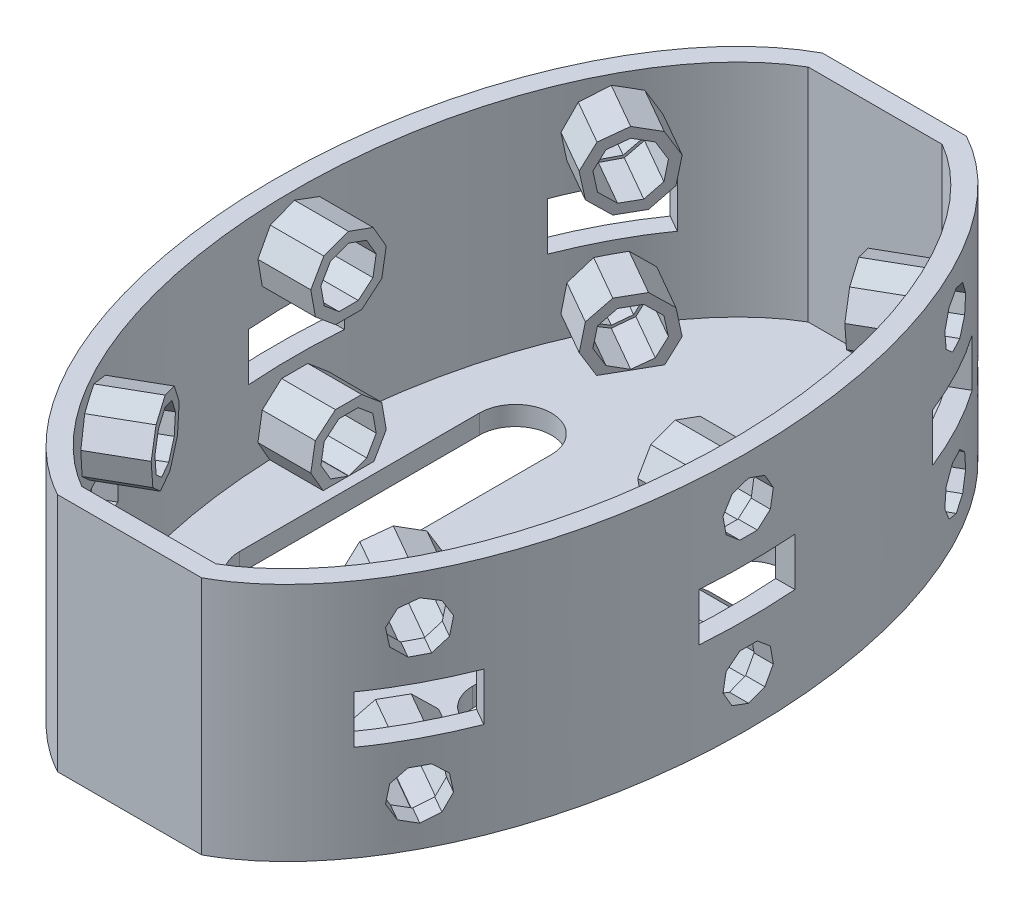
from build123d import *

# Parameters (mm, degrees)
BOSS_EXTRUDE2_DEPTH      = 50
SHELL2_T                 = -4
CUT_EXTRUDE4_DEPTH       = 10
SKETCH8_W                = 20
SKETCH8_H                = 10
CUT_EXTRUDE5_DEPTH       = 10
SKETCH9_W                = 20
SKETCH9_H                = 10
CUT_EXTRUDE6_DEPTH       = 10
SKETCH11_W               = 20
SKETCH11_H               = 10
CUT_EXTRUDE7_DEPTH       = 10
BOSS_EXTRUDE4_DEPTH      = 10
BOSS_EXTRUDE4_DEPTH_BACK = 3
BOSS_EXTRUDE5_DEPTH      = 10
BOSS_EXTRUDE5_DEPTH_BACK = 3
BOSS_EXTRUDE6_DEPTH      = 12.5
BOSS_EXTRUDE6_DEPTH_BACK = 2
BOSS_EXTRUDE7_DEPTH      = 10
BOSS_EXTRUDE7_DEPTH_BACK = 3
BOSS_EXTRUDE8_DEPTH      = 12.5
BOSS_EXTRUDE8_DEPTH_BACK = 2
BOSS_EXTRUDE9_DEPTH      = 3
BOSS_EXTRUDE9_DEPTH_BACK = 10


with BuildPart() as part:
    # Sketch1 → Boss-Extrude2 (new body)
    with BuildSketch(Plane(origin=(0, 0, 0), x_dir=(1, 0, 0), z_dir=(0, 1, 0))):
        with BuildLine():
            Line((-15, 79.656153353), (15, 79.656153353))
            add(Edge.make_bspline(
                [(15, -79.656153353), (161.944166849, 0), (15, 79.656153353)],
                knots=[3.450841036, 3.450841036, 3.450841036, 5.973936924, 5.973936924, 5.973936924], degree=2, weights=[1, 0.30434276, 1]))
            Line((15, -79.656153353), (-15, -79.656153353))
            add(Edge.make_bspline(
                [(-15, 79.656153353), (-161.944166849, 0), (-15, -79.656153353)],
                knots=[0.309248383, 0.309248383, 0.309248383, 2.832344271, 2.832344271, 2.832344271], degree=2, weights=[1, 0.30434276, 1]))
        make_face()
    extrude(amount=BOSS_EXTRUDE2_DEPTH)

    # Shell2
    shell2_openings = [part.faces().sort_by_distance(p)[0] for p in [
        (0, 50, 0),
    ]]
    offset(amount=SHELL2_T, openings=shell2_openings, kind=Kind.INTERSECTION)

    # Sketch7 → Cut-Extrude4 (cut)
    with BuildSketch(Plane(origin=(0, 4, 0), x_dir=(1, 0, 0), z_dir=(0, 1, 0))):
        with BuildLine():
            Line((-16.7865347, 25), (-16.7865347, -25))
            ThreePointArc((-16.7865347, -25), (-24.2865347, -32.5), (-31.7865347, -25))
            Line((-31.7865347, -25), (-31.7865347, 25))
            ThreePointArc((-31.7865347, 25), (-24.2865347, 32.5), (-16.7865347, 25))
        make_face()
        with BuildLine():
            Line((16.7865347, 25), (16.7865347, -25))
            ThreePointArc((16.7865347, -25), (24.2865347, -32.5), (31.7865347, -25))
            Line((31.7865347, -25), (31.7865347, 25))
            ThreePointArc((31.7865347, 25), (24.2865347, 32.5), (16.7865347, 25))
        make_face()
    extrude(amount=-CUT_EXTRUDE4_DEPTH, mode=Mode.SUBTRACT)

    # Sketch8 → Cut-Extrude5 (cut, symmetric)
    with BuildSketch(Plane(origin=(-47.477578486, 0, -27.172215954), x_dir=(0.49671997189616157, 0, -0.8679108649622244), z_dir=(0.8679108649622244, 0, 0.49671997189616157))):
        with Locations((30.27287521, 25)):
            Rectangle(SKETCH8_W, SKETCH8_H)
        Polygon((30.27287521, 45.320888862), (26.852673777, 44.076037345), (25.032822606, 40.923962655), (25.664850285, 37.339555569), (28.453024039, 35), (32.092726382, 35), (34.880900136, 37.339555569), (35.512927815, 40.923962655), (33.693076643, 44.076037345), align=None)
        Polygon((26.852673777, 5.923962655), (30.27287521, 4.679111138), (33.693076643, 5.923962655), (35.512927815, 9.076037345), (34.880900136, 12.660444431), (32.092726382, 15), (28.453024039, 15), (25.664850285, 12.660444431), (25.032822606, 9.076037345), align=None)
    cut_extrude5 = extrude(amount=CUT_EXTRUDE5_DEPTH, both=True, mode=Mode.SUBTRACT)

    # Sketch9 → Cut-Extrude6 (cut, symmetric)
    with BuildSketch(Plane(origin=(-46.545206992, 0, 0), x_dir=(0, 0, -1), z_dir=(1, 0, 0))):
        with Locations((0, 25)):
            Rectangle(SKETCH9_W, SKETCH9_H)
        Polygon((-1.819851171, 35), (1.819851171, 35), (4.608024926, 37.339555569), (5.240052605, 40.923962655), (3.420201433, 44.076037345), (0, 45.320888862), (-3.420201433, 44.076037345), (-5.240052605, 40.923962655), (-4.608024926, 37.339555569), align=None)
        Polygon((0, 4.679111138), (3.420201433, 5.923962655), (5.240052605, 9.076037345), (4.608024926, 12.660444431), (1.819851171, 15), (-1.819851171, 15), (-4.608024926, 12.660444431), (-5.240052605, 9.076037345), (-3.420201433, 5.923962655), align=None)
    cut_extrude6 = extrude(amount=CUT_EXTRUDE6_DEPTH, both=True, mode=Mode.SUBTRACT)

    # Sketch11 → Cut-Extrude7 (cut, symmetric)
    with BuildSketch(Plane(origin=(-47.477578486, 0, 27.172215954), x_dir=(-0.49671997189616157, 0, -0.8679108649622244), z_dir=(0.8679108649622244, 0, -0.49671997189616157))):
        with Locations((-30.27287521, 25)):
            Rectangle(SKETCH11_W, SKETCH11_H)
        Polygon((-34.880900136, 37.339555569), (-32.092726382, 35), (-28.453024039, 35), (-25.664850285, 37.339555569), (-25.032822606, 40.923962655), (-26.852673777, 44.076037345), (-30.27287521, 45.320888862), (-33.693076643, 44.076037345), (-35.512927815, 40.923962655), align=None)
        Polygon((-35.512927815, 9.076037345), (-33.693076643, 5.923962655), (-30.27287521, 4.679111138), (-26.852673777, 5.923962655), (-25.032822606, 9.076037345), (-25.664850285, 12.660444431), (-28.453024039, 15), (-32.092726382, 15), (-34.880900136, 12.660444431), align=None)
    cut_extrude7 = extrude(amount=CUT_EXTRUDE7_DEPTH, both=True, mode=Mode.SUBTRACT)

    # Mirror1: Cut-Extrude5, Cut-Extrude6, Cut-Extrude7 across plane
    add(cut_extrude5.mirror(Plane(origin=(0, 0, 0), x_dir=(0, 0, 1), z_dir=(1, 0, 0))), mode=Mode.SUBTRACT)
    add(cut_extrude6.mirror(Plane(origin=(0, 0, 0), x_dir=(0, 0, 1), z_dir=(1, 0, 0))), mode=Mode.SUBTRACT)
    add(cut_extrude7.mirror(Plane(origin=(0, 0, 0), x_dir=(0, 0, 1), z_dir=(1, 0, 0))), mode=Mode.SUBTRACT)

    # Sketch12 → Boss-Extrude4 (add, two sides: drawn at the far end of the back side and taken through both)
    # profile 1 of 2: a face of its own
    with BuildSketch(Plane(origin=(-47.477578486, 0, 27.172215954), x_dir=(-0.49671997189616157, 0, -0.8679108649622244), z_dir=(0.8679108649622244, 0, -0.49671997189616157)).offset(-BOSS_EXTRUDE4_DEPTH_BACK)):
        Polygon((-37.184912599, 36.009333353), (-33.002651967, 32.5), (-27.543098453, 32.5), (-23.360837822, 36.009333353), (-22.412796303, 41.385943982), (-25.14257306, 46.114056018), (-30.27287521, 47.981333294), (-35.40317736, 46.114056018), (-38.132954117, 41.385943982), align=None)
        Polygon((-26.510653634, 44.48364108), (-30.27287521, 45.852977749), (-34.035096787, 44.48364108), (-36.036933075, 41.01635892), (-35.341702628, 37.073511126), (-32.274711499, 34.5), (-28.271038922, 34.5), (-25.204047792, 37.073511126), (-24.508817345, 41.01635892), align=None, mode=Mode.SUBTRACT)
    # profile 2 of 2: a face of its own
    with BuildSketch(Plane(origin=(-47.477578486, 0, 27.172215954), x_dir=(-0.49671997189616157, 0, -0.8679108649622244), z_dir=(0.8679108649622244, 0, -0.49671997189616157)).offset(-BOSS_EXTRUDE4_DEPTH_BACK)):
        Polygon((-35.40317736, 3.885943982), (-30.27287521, 2.018666706), (-25.14257306, 3.885943982), (-22.412796303, 8.614056018), (-23.360837822, 13.990666647), (-27.543098453, 17.5), (-33.002651967, 17.5), (-37.184912599, 13.990666647), (-38.132954117, 8.614056018), align=None)
        Polygon((-34.035096787, 5.51635892), (-30.27287521, 4.147022251), (-26.510653634, 5.51635892), (-24.508817345, 8.98364108), (-25.204047792, 12.926488874), (-28.271038922, 15.5), (-32.274711499, 15.5), (-35.341702628, 12.926488874), (-36.036933075, 8.98364108), align=None, mode=Mode.SUBTRACT)
    extrude(amount=BOSS_EXTRUDE4_DEPTH + BOSS_EXTRUDE4_DEPTH_BACK)

    # Sketch13 → Boss-Extrude5 (add, two sides: drawn at the far end of the back side and taken through both)
    # profile 1 of 2: a face of its own
    with BuildSketch(Plane(origin=(-47.477578486, 0, -27.172215954), x_dir=(0.49671997189616157, 0, -0.8679108649622244), z_dir=(0.8679108649622244, 0, 0.49671997189616157)).offset(-BOSS_EXTRUDE5_DEPTH_BACK)):
        Polygon((25.14257306, 3.885943982), (30.27287521, 2.018666706), (35.40317736, 3.885943982), (38.132954117, 8.614056018), (37.184912599, 13.990666647), (33.002651967, 17.5), (27.543098453, 17.5), (23.360837822, 13.990666647), (22.412796303, 8.614056018), align=None)
        Polygon((30.27287521, 4.147022251), (34.035096787, 5.51635892), (36.036933075, 8.98364108), (35.341702628, 12.926488874), (32.274711499, 15.5), (28.271038922, 15.5), (25.204047792, 12.926488874), (24.508817345, 8.98364108), (26.510653634, 5.51635892), align=None, mode=Mode.SUBTRACT)
    # profile 2 of 2: a face of its own
    with BuildSketch(Plane(origin=(-47.477578486, 0, -27.172215954), x_dir=(0.49671997189616157, 0, -0.8679108649622244), z_dir=(0.8679108649622244, 0, 0.49671997189616157)).offset(-BOSS_EXTRUDE5_DEPTH_BACK)):
        Polygon((27.543098453, 32.484276794), (33.002651967, 32.484276794), (37.184912599, 35.993610148), (38.132954117, 41.370220776), (35.40317736, 46.098332813), (30.27287521, 47.965610088), (25.14257306, 46.098332813), (22.412796303, 41.370220776), (23.360837822, 35.993610148), align=None)
        Polygon((28.271038922, 34.484276794), (32.274711499, 34.484276794), (35.341702628, 37.05778792), (36.036933075, 41.000635714), (34.035096787, 44.467917874), (30.27287521, 45.837254543), (26.510653634, 44.467917874), (24.508817345, 41.000635714), (25.204047792, 37.05778792), align=None, mode=Mode.SUBTRACT)
    extrude(amount=BOSS_EXTRUDE5_DEPTH + BOSS_EXTRUDE5_DEPTH_BACK)

    # Sketch14 → Boss-Extrude6 (add, two sides: drawn at the far end of the back side and taken through both)
    # profile 1 of 2: a face of its own
    with BuildSketch(Plane(origin=(-46.545206992, 0, 0), x_dir=(0, 0, -1), z_dir=(1, 0, 0)).offset(-BOSS_EXTRUDE6_DEPTH_BACK)):
        Polygon((-6.90108084, 36.150860366), (-2.709223672, 32.652995581), (2.750309362, 32.667949549), (6.922942079, 36.188725143), (7.856253258, 41.567912332), (5.113536224, 46.288529648), (-0.021861239, 48.141747785), (-5.147029586, 46.260425381), (-7.863845587, 41.524854096), align=None)
        Polygon((-5.060792616, 37.220082783), (-1.986764026, 34.654981941), (2.016893532, 34.665948184), (5.076824192, 37.247850286), (5.761252389, 41.192587558), (3.749926565, 44.65437359), (-0.016031575, 46.013400224), (-3.774488363, 44.633763794), (-5.766820097, 41.161011519), align=None, mode=Mode.SUBTRACT)
    # profile 2 of 2: a face of its own
    with BuildSketch(Plane(origin=(-46.545206992, 0, 0), x_dir=(0, 0, -1), z_dir=(1, 0, 0)).offset(-BOSS_EXTRUDE6_DEPTH_BACK)):
        Polygon((-7.860089501, 8.45367167), (-5.130348886, 3.725538767), (-6.101e-05, 1.858222275), (5.130255413, 3.725460334), (7.860068312, 8.453551504), (6.912067893, 13.830169379), (2.729834088, 17.339534702), (-2.729719426, 17.339576435), (-6.912006883, 13.830275052), align=None)
        Polygon((-3.742923063, 5.339791634), (0.02514709, 3.986631842), (3.781450641, 5.37212011), (5.76837141, 8.847971079), (5.056207088, 12.787795451), (1.978187276, 15.348105616), (-2.025448347, 15.330903993), (-5.081354179, 12.744239413), (-5.759637917, 8.79844098), align=None, mode=Mode.SUBTRACT)
    extrude(amount=BOSS_EXTRUDE6_DEPTH + BOSS_EXTRUDE6_DEPTH_BACK)

    # Sketch15 → Boss-Extrude7 (add, two sides: drawn at the far end of the back side and taken through both)
    # profile 1 of 2: a face of its own
    with BuildSketch(Plane(origin=(47.477578486, 0, 27.172215954), x_dir=(-0.4967199718961614, 0, 0.8679108649622245), z_dir=(-0.8679108649622245, 0, -0.4967199718961614)).offset(-BOSS_EXTRUDE7_DEPTH_BACK)):
        Polygon((23.360837822, 36.169777784), (27.543098453, 32.660444431), (33.002651967, 32.660444431), (37.184912599, 36.169777784), (38.132954117, 41.546388413), (35.40317736, 46.274500449), (30.27287521, 48.141777725), (25.14257306, 46.274500449), (22.412796303, 41.546388413), align=None)
        Polygon((25.204047792, 37.233955557), (28.271038922, 34.660444431), (32.274711499, 34.660444431), (35.341702628, 37.233955557), (36.036933075, 41.176803351), (34.035096787, 44.644085511), (30.27287521, 46.01342218), (26.510653634, 44.644085511), (24.508817345, 41.176803351), align=None, mode=Mode.SUBTRACT)
    # profile 2 of 2: a face of its own
    with BuildSketch(Plane(origin=(47.477578486, 0, 27.172215954), x_dir=(-0.4967199718961614, 0, 0.8679108649622245), z_dir=(-0.8679108649622245, 0, -0.4967199718961614)).offset(-BOSS_EXTRUDE7_DEPTH_BACK)):
        Polygon((22.412798088, 8.453608489), (25.142574225, 3.725497526), (30.27287521, 1.858220675), (35.403176195, 3.725497526), (38.132952332, 8.453608489), (37.184911029, 13.830217897), (33.002651347, 17.339550453), (27.543099073, 17.339550453), (23.360839391, 13.830217897), align=None)
        Polygon((24.508817345, 8.823193236), (26.510653634, 5.355911076), (30.27287521, 3.986574408), (34.035096787, 5.355911076), (36.036933075, 8.823193236), (35.341702628, 12.76604103), (32.274711499, 15.339552156), (28.271038922, 15.339552156), (25.204047792, 12.76604103), align=None, mode=Mode.SUBTRACT)
    extrude(amount=BOSS_EXTRUDE7_DEPTH + BOSS_EXTRUDE7_DEPTH_BACK)

    # Sketch16 → Boss-Extrude8 (add, two sides: drawn at the far end of the back side and taken through both)
    # profile 1 of 2: a face of its own
    with BuildSketch(Plane.ZY.offset(-46.545206992).offset(-BOSS_EXTRUDE8_DEPTH_BACK)):
        Polygon((-7.860078907, 8.453611587), (-5.13030215, 3.725499551), (0, 1.858222275), (5.13030215, 3.725499551), (7.860078907, 8.453611587), (6.912037388, 13.830222216), (2.729776757, 17.339555569), (-2.729776757, 17.339555569), (-6.912037388, 13.830222216), align=None)
        Polygon((-5.764057865, 8.823196649), (-3.762221577, 5.355914489), (0, 3.98657782), (3.762221577, 5.355914489), (5.764057865, 8.823196649), (5.068827418, 12.766044443), (2.001836288, 15.339555569), (-2.001836288, 15.339555569), (-5.068827418, 12.766044443), align=None, mode=Mode.SUBTRACT)
    # profile 2 of 2: a face of its own
    with BuildSketch(Plane.ZY.offset(-46.545206992).offset(-BOSS_EXTRUDE8_DEPTH_BACK)):
        Polygon((-6.912037388, 36.169777784), (-2.729776757, 32.660444431), (2.729776757, 32.660444431), (6.912037388, 36.169777784), (7.860078907, 41.546388413), (5.13030215, 46.274500449), (0, 48.141777725), (-5.13030215, 46.274500449), (-7.860078907, 41.546388413), align=None)
        Polygon((-5.068827418, 37.233955557), (-2.001836288, 34.660444431), (2.001836288, 34.660444431), (5.068827418, 37.233955557), (5.764057865, 41.176803351), (3.762221577, 44.644085511), (0, 46.01342218), (-3.762221577, 44.644085511), (-5.764057865, 41.176803351), align=None, mode=Mode.SUBTRACT)
    extrude(amount=BOSS_EXTRUDE8_DEPTH + BOSS_EXTRUDE8_DEPTH_BACK)

    # Sketch17 → Boss-Extrude9 (add, two sides: drawn at the far end of the back side and taken through both)
    # profile 1 of 2: a face of its own
    with BuildSketch(Plane(origin=(47.477578486, 0, -27.172215954), x_dir=(-0.4967199718961618, 0, -0.8679108649622244), z_dir=(0.8679108649622244, 0, -0.4967199718961618)).offset(-BOSS_EXTRUDE9_DEPTH_BACK)):
        Polygon((38.132954117, 8.453611587), (37.184912599, 13.830222216), (33.002651967, 17.339555569), (27.543098453, 17.339555569), (23.360837822, 13.830222216), (22.412796303, 8.453611587), (25.14257306, 3.725499551), (30.27287521, 1.858222275), (35.40317736, 3.725499551), align=None)
        Polygon((36.036933075, 8.823196649), (35.341702628, 12.766044443), (32.274711499, 15.339555569), (28.271038922, 15.339555569), (25.204047792, 12.766044443), (24.508817345, 8.823196649), (26.510653634, 5.355914489), (30.27287521, 3.98657782), (34.035096787, 5.355914489), align=None, mode=Mode.SUBTRACT)
    # profile 2 of 2: a face of its own
    with BuildSketch(Plane(origin=(47.477578486, 0, -27.172215954), x_dir=(-0.4967199718961618, 0, -0.8679108649622244), z_dir=(0.8679108649622244, 0, -0.4967199718961618)).offset(-BOSS_EXTRUDE9_DEPTH_BACK)):
        Polygon((30.27287521, 48.141777725), (25.14257306, 46.274500449), (22.412796303, 41.546388413), (23.360837822, 36.169777784), (27.543098453, 32.660444431), (33.002651967, 32.660444431), (37.184912599, 36.169777784), (38.132954117, 41.546388413), (35.40317736, 46.274500449), align=None)
        Polygon((30.27287521, 46.01342218), (26.510653634, 44.644085511), (24.508817345, 41.176803351), (25.204047792, 37.233955557), (28.271038922, 34.660444431), (32.274711499, 34.660444431), (35.341702628, 37.233955557), (36.036933075, 41.176803351), (34.035096787, 44.644085511), align=None, mode=Mode.SUBTRACT)
    extrude(amount=BOSS_EXTRUDE9_DEPTH + BOSS_EXTRUDE9_DEPTH_BACK)


solid = part.part
